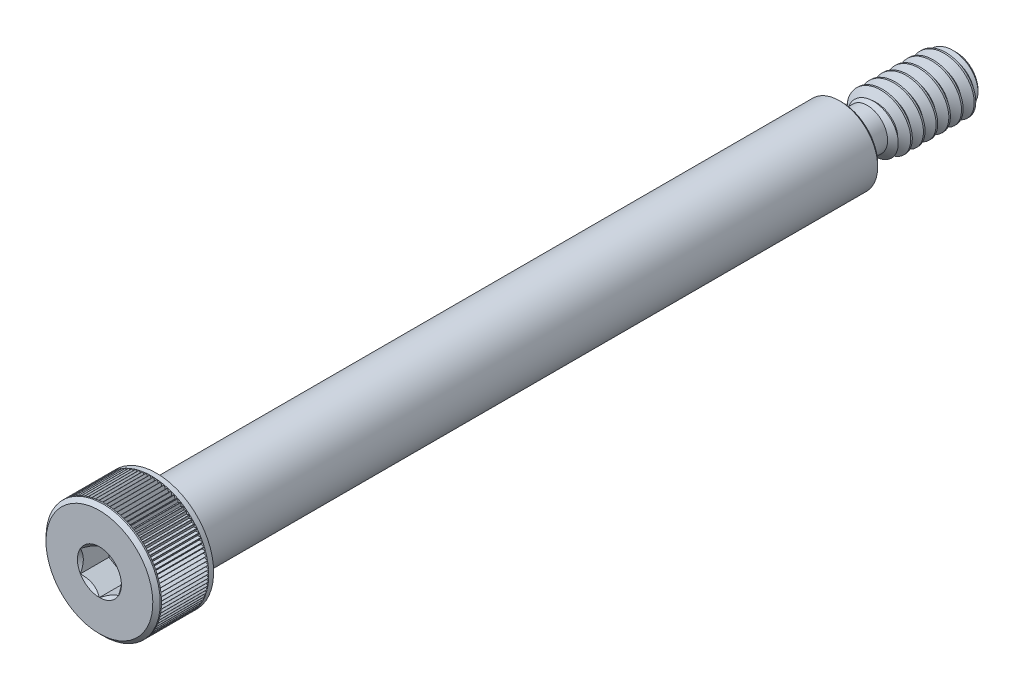
from build123d import *

# Parameters (mm, degrees)
CHAMFER1_SIZE      = 0.60325
CHAMFER2_SIZE      = 0.3095625
CHAMFER3_SIZE      = 0.2032
CUT_EXTRUDE5_DEPTH = 1.968103125
CIRPATTERN1_COUNT  = 99
CUT_EXTRUDE2_DEPTH = 2.38125
CUT_SWEEP1_PITCH   = 1.058333333


with BuildPart() as part:
    # Sketch1 → Revolve1 (revolve)
    with BuildSketch(Plane(origin=(0, 0, 0), x_dir=(0, 0, -1), z_dir=(1, 0, 0))):
        Polygon((0, 4.7625), (4.7625, 4.7625), (4.7625, 3.175), (61.9125, 3.175), (61.9125, 2.413), (71.4375, 2.413), (71.4375, 0), (0, 0), align=None)
    revolve(axis=Axis((0, 0, -71.4375), (0, 0, 1)))

    # Sketch5 → Cut-Revolve1 (revolve, cut)
    with BuildSketch(Plane(origin=(0, 0, 0), x_dir=(0, 0, -1), z_dir=(1, 0, 0))):
        with BuildLine():
            Line((61.9125, 3.175), (65.5066, 3.175))
            Line((65.5066, 3.175), (64.0207, 1.6891))
            Line((64.0207, 1.6891), (62.6364, 1.6891))
            ThreePointArc((62.6364, 1.6891), (62.124525401, 1.901125401), (61.9125, 2.413))
            Line((61.9125, 2.413), (61.9125, 3.175))
        make_face()
    revolve(axis=Axis((0, 0, -71.4375), (0, 0, 1)), mode=Mode.SUBTRACT)

    # Chamfer1
    chamfer1_edges = [part.edges().sort_by_distance(p)[0] for p in [
        (0, -2.413, -71.4375),
    ]]
    chamfer(chamfer1_edges, length=CHAMFER1_SIZE)

    # Chamfer2
    chamfer2_edges = [part.edges().sort_by_distance(p)[0] for p in [
        (0, -4.7625, 0),
    ]]
    chamfer(chamfer2_edges, length=CHAMFER2_SIZE)

    # Chamfer3
    chamfer3_edges = [part.edges().sort_by_distance(p)[0] for p in [
        (0, -3.175, -61.9125),
    ]]
    chamfer(chamfer3_edges, length=CHAMFER3_SIZE)

    # Sketch11 → Cut-Extrude5 (cut, symmetric)
    with BuildSketch(Plane.XY.offset(-2.38125)):
        Polygon((0, 4.51485), (0.142980794, 4.7625), (-0.142980794, 4.7625), align=None)
    cut_extrude5 = extrude(amount=CUT_EXTRUDE5_DEPTH, both=True, mode=Mode.SUBTRACT)

    # CirPattern1: Cut-Extrude5 ×99 about axis
    cirpattern1_axis = Axis((0, 0, 0), (0, 0, 1))
    for i in range(1, CIRPATTERN1_COUNT):
        add(cut_extrude5.rotate(cirpattern1_axis, i * 360 / CIRPATTERN1_COUNT), mode=Mode.SUBTRACT)

    # Sketch8 → Cut-Extrude2 (cut)
    with BuildSketch(Plane.XY):
        Polygon((1.5875, 0.916543552), (0, 1.833087105), (-1.5875, 0.916543552), (-1.5875, -0.916543552), (0, -1.833087105), (1.5875, -0.916543552), align=None)
    extrude(amount=-CUT_EXTRUDE2_DEPTH, mode=Mode.SUBTRACT)

    # Cut-Extrude4 cone 1 section (through the dimple's axis) → Cut-Extrude4 (revolve, cut)
    with BuildSketch(Plane(origin=(0, 0, 0), x_dir=(0, -1, 0), z_dir=(1, 0, 0))):
        Polygon((0, 0), (1.833087105, 0), (0, 1.833087105), align=None)
    revolve(axis=Axis((0, 0, 0), (0, 0, -1)), mode=Mode.SUBTRACT)

    # Cut-Sweep1: the profile of Sketch4 screwed along a right-hand helix of 10 turns, 8 arcs to a turn; built about Z, then put on its axis
    cut_sweep1_z = Axis((0, 0, 0), (0, 0, 1))
    cut_sweep1_corners = [(2.470283972, 0, 0.033072917), (2.470283972, 0, -0.959114583), (1.725592336, 0, -0.529166667), (1.725592336, 0, -0.396875)]
    with BuildLine(mode=Mode.PRIVATE) as cut_sweep1_profile:
        Line(cut_sweep1_corners[0], cut_sweep1_corners[1])
        Line(cut_sweep1_corners[1], cut_sweep1_corners[2])
        Line(cut_sweep1_corners[2], cut_sweep1_corners[3])
        Line(cut_sweep1_corners[3], cut_sweep1_corners[0])
    cut_sweep1_cap = Face(cut_sweep1_profile.wire())
    cut_sweep1_turn_angles = [0, 22.5, 45, 67.5, 90, 112.5, 135, 157.5, 180, 202.5, 225, 247.5, 270, 292.5, 315, 337.5, 360]
    cut_sweep1_turn_weights = [1, 0.9238795325112867, 1, 0.9238795325112867, 1, 0.9238795325112867, 1, 0.9238795325112867, 1, 0.9238795325112867, 1, 0.9238795325112867, 1, 0.9238795325112867, 1, 0.9238795325112867, 1]
    cut_sweep1_turn_rails = [Edge.make_bspline([Vector(p[0], p[1], 0).rotate(cut_sweep1_z, cut_sweep1_turn_angles[k]) / cut_sweep1_turn_weights[k] + Vector(0, 0, p[2] + CUT_SWEEP1_PITCH * cut_sweep1_turn_angles[k] / 360) for k in range(17)], [0, 0, 0, 1, 1, 2, 2, 3, 3, 4, 4, 5, 5, 6, 6, 7, 7, 8, 8, 8], 2, cut_sweep1_turn_weights) for p in cut_sweep1_corners]
    cut_sweep1_turn_sides = [Face.make_surface_from_curves(cut_sweep1_turn_rails[p[0]], cut_sweep1_turn_rails[p[1]]) for p in [(0, 1), (1, 2), (2, 3), (3, 0)]]
    cut_sweep1 = Plane(origin=(0, 0, -71.4375), x_dir=(0, 1, 0), z_dir=(0, 0, 1)) * Solid(Shell([*[p.moved(Location((0, 0, CUT_SWEEP1_PITCH * i))) for i in range(10) for p in cut_sweep1_turn_sides], cut_sweep1_cap, cut_sweep1_cap.rotate(cut_sweep1_z, 3600).moved(Location((0, 0, CUT_SWEEP1_PITCH * 3600 / 360)))]))
    add(cut_sweep1, mode=Mode.SUBTRACT)

    # Sketch12 → Revolve2 (revolve)
    with BuildSketch(Plane(origin=(0, 0, 0), x_dir=(0, 0, -1), z_dir=(1, 0, 0))):
        with BuildLine():
            Line((61.9125, 2.9718), (61.7093, 3.175))
            Line((61.7093, 3.175), (4.7625, 3.175))
            Line((4.7625, 3.175), (4.7625, 0))
            Line((4.7625, 0), (61.9125, 0))
            Line((61.9125, 0), (64.0207, 0))
            Line((64.0207, 0), (64.0207, 1.6891))
            Line((64.0207, 1.6891), (62.6364, 1.6891))
            ThreePointArc((62.6364, 1.6891), (62.124525401, 1.901125401), (61.9125, 2.413))
            Line((61.9125, 2.413), (61.9125, 2.9718))
        make_face()
    revolve(axis=Axis((0, 0, -4.7625), (0, 0, -1)))


solid = part.part
